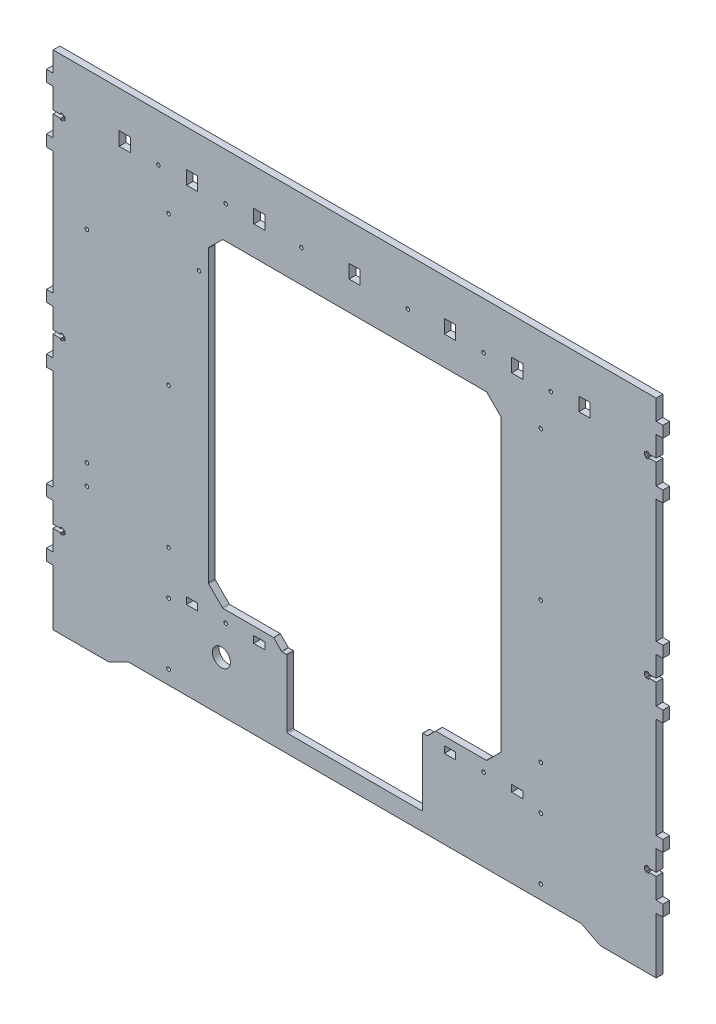
from build123d import *

# Parameters (mm, degrees)
SKETCH_2_R      = 1.6
SKETCH_2_R_2    = 1.7
SKETCH_2_R_3    = 8.05
SKETCH_2_W      = 10
SKETCH_2_H      = 12.1
SKETCH_2_H_2    = 6.1
EXTRUDE_2_DEPTH = 6


with BuildPart() as part:
    # Эскиз2 → Бобышка-Вытянуть2 (new body)
    with BuildSketch(Plane.XY):
        Polygon((39.191925364, 477.007239), (39.191925364, 472.107239), (33.191925364, 472.007239), (33.191925364, 462.007239), (39.191925364, 461.907239), (39.191925364, 443.557239), (45.991925364, 443.557239), (45.991925364, 444.757239), (48.191925364, 444.757239), (48.191925364, 443.557239), (49.691925364, 443.557239), (49.691925364, 440.457239), (48.191925364, 440.457239), (48.191925364, 439.257239), (45.991925364, 439.257239), (45.991925364, 440.457239), (39.191925364, 440.457239), (39.191925364, 422.107239), (33.191925364, 422.007239), (33.191925364, 412.007239), (39.191925364, 411.907239), (39.191925364, 302.107239), (33.191925364, 302.007239), (33.191925364, 292.007239), (39.191925364, 291.907239), (39.191925364, 273.557239), (45.991925364, 273.557239), (45.991925364, 274.757239), (48.191925364, 274.757239), (48.191925364, 273.557239), (49.691925364, 273.557239), (49.691925364, 270.457239), (48.191925364, 270.457239), (48.191925364, 269.257239), (45.991925364, 269.257239), (45.991925364, 270.457239), (39.191925364, 270.457239), (39.191925364, 252.107239), (33.191925364, 252.007239), (33.191925364, 242.007239), (39.191925364, 241.907239), (39.191925364, 152.107239), (33.191925364, 152.007239), (33.191925364, 142.007239), (39.191925364, 141.907239), (39.191925364, 123.557239), (45.991925364, 123.557239), (45.991925364, 124.757239), (48.191925364, 124.757239), (48.191925364, 123.557239), (49.691925364, 123.557239), (49.691925364, 120.457239), (48.191925364, 120.457239), (48.191925364, 119.257239), (45.991925364, 119.257239), (45.991925364, 120.457239), (39.191925364, 120.457239), (39.191925364, 102.107239), (33.191925364, 102.007239), (33.191925364, 92.007239), (39.191925364, 91.907239), (39.191925364, 42.007239), (89.191925364, 42.007239), (106.191925364, 50.707239), (510.191925364, 50.707239), (527.191925364, 42.007239), (577.191925364, 42.007239), (577.191925364, 91.907239), (583.191925364, 92.007239), (583.191925364, 102.007239), (577.191925364, 102.107239), (577.191925364, 120.457239), (570.391925364, 120.457239), (570.391925364, 119.257239), (568.191925364, 119.257239), (568.191925364, 120.457239), (566.691925364, 120.457239), (566.691925364, 123.557239), (568.191925364, 123.557239), (568.191925364, 124.757239), (570.391925364, 124.757239), (570.391925364, 123.557239), (577.191925364, 123.557239), (577.191925364, 141.907239), (583.191925364, 142.007239), (583.191925364, 152.007239), (577.191925364, 152.107239), (577.191925364, 241.907239), (583.191925364, 242.007239), (583.191925364, 252.007239), (577.191925364, 252.107239), (577.191925364, 270.457239), (570.391925364, 270.457239), (570.391925364, 269.257239), (568.191925364, 269.257239), (568.191925364, 270.457239), (566.691925364, 270.457239), (566.691925364, 273.557239), (568.191925364, 273.557239), (568.191925364, 274.757239), (570.391925364, 274.757239), (570.391925364, 273.557239), (577.191925364, 273.557239), (577.191925364, 291.907239), (583.191925364, 292.007239), (583.191925364, 302.007239), (577.191925364, 302.107239), (577.191925364, 411.907239), (583.191925364, 412.007239), (583.191925364, 422.007239), (577.191925364, 422.107239), (577.191925364, 440.457239), (570.391925364, 440.457239), (570.391925364, 439.257239), (568.191925364, 439.257239), (568.191925364, 440.457239), (566.691925364, 440.457239), (566.691925364, 443.557239), (568.191925364, 443.557239), (568.191925364, 444.757239), (570.391925364, 444.757239), (570.391925364, 443.557239), (577.191925364, 443.557239), (577.191925364, 461.907239), (583.191925364, 462.007239), (583.191925364, 472.007239), (577.191925364, 472.107239), (577.191925364, 477.007239), (577.191925364, 490.007239), (267.191925364, 490.007239), (39.191925364, 490.007239), align=None)
        with Locations((260.691925364, 448.057239)):
            Circle(SKETCH_2_R, mode=Mode.SUBTRACT)
        with Locations((193.191925364, 448.057239)):
            Circle(SKETCH_2_R, mode=Mode.SUBTRACT)
        with Locations((169.364369364, 384.459314)):
            Circle(SKETCH_2_R, mode=Mode.SUBTRACT)
        with Locations((69.364369364, 366.459314)):
            Circle(SKETCH_2_R, mode=Mode.SUBTRACT)
        with Locations((69.364369364, 186.089314)):
            Circle(SKETCH_2_R, mode=Mode.SUBTRACT)
        with Locations((69.364369364, 168.089314)):
            Circle(SKETCH_2_R, mode=Mode.SUBTRACT)
        with Locations((193.191925364, 124.054914)):
            Circle(SKETCH_2_R, mode=Mode.SUBTRACT)
        with Locations((142.191925364, 117.904914)):
            Circle(SKETCH_2_R_2, mode=Mode.SUBTRACT)
        with Locations((142.191925364, 63.104914)):
            Circle(SKETCH_2_R_2, mode=Mode.SUBTRACT)
        with Locations((189.304525403, 95.826887814)):
            Circle(SKETCH_2_R_3, mode=Mode.SUBTRACT)
        with Locations((474.191925364, 63.104914)):
            Circle(SKETCH_2_R_2, mode=Mode.SUBTRACT)
        with Locations((474.191925364, 117.904914)):
            Circle(SKETCH_2_R_2, mode=Mode.SUBTRACT)
        with Locations((423.191925364, 124.054914)):
            Circle(SKETCH_2_R, mode=Mode.SUBTRACT)
        with Locations((423.191925364, 448.057239)):
            Circle(SKETCH_2_R, mode=Mode.SUBTRACT)
        with Locations((355.691925364, 448.057239)):
            Circle(SKETCH_2_R, mode=Mode.SUBTRACT)
        with Locations((483.191925364, 448.057239)):
            Circle(SKETCH_2_R, mode=Mode.SUBTRACT)
        with Locations((133.191925364, 448.057239)):
            Circle(SKETCH_2_R, mode=Mode.SUBTRACT)
        with Locations((474.191925364, 415.007239)):
            Circle(SKETCH_2_R, mode=Mode.SUBTRACT)
        with Locations((474.191925364, 282.507239)):
            Circle(SKETCH_2_R, mode=Mode.SUBTRACT)
        with Locations((474.191925364, 157.104914)):
            Circle(SKETCH_2_R, mode=Mode.SUBTRACT)
        with Locations((142.191925364, 157.104914)):
            Circle(SKETCH_2_R, mode=Mode.SUBTRACT)
        with Locations((142.191925364, 282.507239)):
            Circle(SKETCH_2_R, mode=Mode.SUBTRACT)
        with Locations((142.191925364, 415.007239)):
            Circle(SKETCH_2_R, mode=Mode.SUBTRACT)
        with Locations((308.191925364, 451.057239)):
            Rectangle(SKETCH_2_W, SKETCH_2_H, mode=Mode.SUBTRACT)
        with Locations((223.191925364, 124.054914)):
            Rectangle(SKETCH_2_W, SKETCH_2_H_2, mode=Mode.SUBTRACT)
        with Locations((163.191925364, 124.054914)):
            Rectangle(SKETCH_2_W, SKETCH_2_H_2, mode=Mode.SUBTRACT)
        with Locations((163.191925364, 451.057239)):
            Rectangle(SKETCH_2_W, SKETCH_2_H, mode=Mode.SUBTRACT)
        with Locations((223.191925364, 451.057239)):
            Rectangle(SKETCH_2_W, SKETCH_2_H, mode=Mode.SUBTRACT)
        with BuildLine():
            Line((367.691925364, 66.604914), (248.691925364, 66.604914))
            ThreePointArc((248.691925364, 66.604914), (247.984818583, 66.897807219), (247.691925364, 67.604914))
            Line((247.691925364, 67.604914), (247.691925364, 126.604914))
            ThreePointArc((247.691925364, 126.604914), (247.545478755, 126.958467391), (247.191925364, 127.104914))
            Line((247.191925364, 127.104914), (243.399032145, 127.104914))
            ThreePointArc((243.399032145, 127.104914), (243.207690429, 127.142974234), (243.045478755, 127.251360609))
            Line((243.045478755, 127.251360609), (239.551511864, 130.7453275))
            Line((239.551511864, 130.7453275), (236.057544974, 134.239294391))
            ThreePointArc((236.057544974, 134.239294391), (235.895333299, 134.347680766), (235.703991583, 134.385741))
            Line((235.703991583, 134.385741), (213.330786974, 134.385741))
            Line((213.330786974, 134.385741), (190.957582097, 134.385741))
            ThreePointArc((190.957582097, 134.385741), (190.576531552, 134.461186793), (190.252978328, 134.676140036))
            Line((190.252978328, 134.676140036), (184.106371864, 140.7794605))
            Line((184.106371864, 140.7794605), (177.959765595, 146.882780771))
            ThreePointArc((177.959765595, 146.882780771), (177.74116739, 147.20806661), (177.664369364, 147.592381735))
            Line((177.664369364, 147.592381735), (177.664369364, 169.701128817))
            Line((177.664369364, 169.701128817), (177.664369364, 405.962673265))
            ThreePointArc((177.664369364, 405.962673265), (177.741167398, 406.346988409), (177.959765623, 406.672274257))
            Line((177.959765623, 406.672274257), (184.106372364, 412.7755945))
            Line((184.106372364, 412.7755945), (190.252979357, 418.878914993))
            ThreePointArc((190.252979357, 418.878914993), (190.576532571, 419.093868215), (190.957583097, 419.169314))
            Line((190.957583097, 419.169314), (308.137936364, 419.169314))
            Line((308.137936364, 419.169314), (308.245914364, 419.169314))
            Line((308.245914364, 419.169314), (425.426267631, 419.169314))
            ThreePointArc((425.426267631, 419.169314), (425.807318157, 419.093868215), (426.130871372, 418.878914993))
            Line((426.130871372, 418.878914993), (432.277478364, 412.7755945))
            Line((432.277478364, 412.7755945), (438.424085105, 406.672274257))
            ThreePointArc((438.424085105, 406.672274257), (438.64268333, 406.346988409), (438.719481364, 405.962673265))
            Line((438.719481364, 405.962673265), (438.719481364, 169.701128817))
            Line((438.719481364, 169.701128817), (438.719481364, 147.592381735))
            ThreePointArc((438.719481364, 147.592381735), (438.642683338, 147.20806661), (438.424085134, 146.882780771))
            Line((438.424085134, 146.882780771), (432.277478864, 140.7794605))
            Line((432.277478864, 140.7794605), (426.1308724, 134.676140036))
            ThreePointArc((426.1308724, 134.676140036), (425.807319176, 134.461186793), (425.426268631, 134.385741))
            Line((425.426268631, 134.385741), (403.053063755, 134.385741))
            Line((403.053063755, 134.385741), (380.679859145, 134.385741))
            ThreePointArc((380.679859145, 134.385741), (380.488517429, 134.347680766), (380.326305755, 134.239294391))
            Line((380.326305755, 134.239294391), (376.832338864, 130.7453275))
            Line((376.832338864, 130.7453275), (373.338371974, 127.251360609))
            ThreePointArc((373.338371974, 127.251360609), (373.176160299, 127.142974234), (372.984818583, 127.104914))
            Line((372.984818583, 127.104914), (369.191925364, 127.104914))
            ThreePointArc((369.191925364, 127.104914), (368.838371974, 126.958467391), (368.691925364, 126.604914))
            Line((368.691925364, 126.604914), (368.691925364, 67.604914))
            ThreePointArc((368.691925364, 67.604914), (368.399032145, 66.897807219), (367.691925364, 66.604914))
        make_face(mode=Mode.SUBTRACT)
        with Locations((103.191925364, 451.057239)):
            Rectangle(SKETCH_2_W, SKETCH_2_H, mode=Mode.SUBTRACT)
        with Locations((513.191925364, 451.057239)):
            Rectangle(SKETCH_2_W, SKETCH_2_H, mode=Mode.SUBTRACT)
        with Locations((393.191925364, 451.057239)):
            Rectangle(SKETCH_2_W, SKETCH_2_H, mode=Mode.SUBTRACT)
        with Locations((453.191925364, 451.057239)):
            Rectangle(SKETCH_2_W, SKETCH_2_H, mode=Mode.SUBTRACT)
        with Locations((453.191925364, 124.054914)):
            Rectangle(SKETCH_2_W, SKETCH_2_H_2, mode=Mode.SUBTRACT)
        with Locations((393.191925364, 124.054914)):
            Rectangle(SKETCH_2_W, SKETCH_2_H_2, mode=Mode.SUBTRACT)
    extrude(amount=EXTRUDE_2_DEPTH)


solid = part.part
